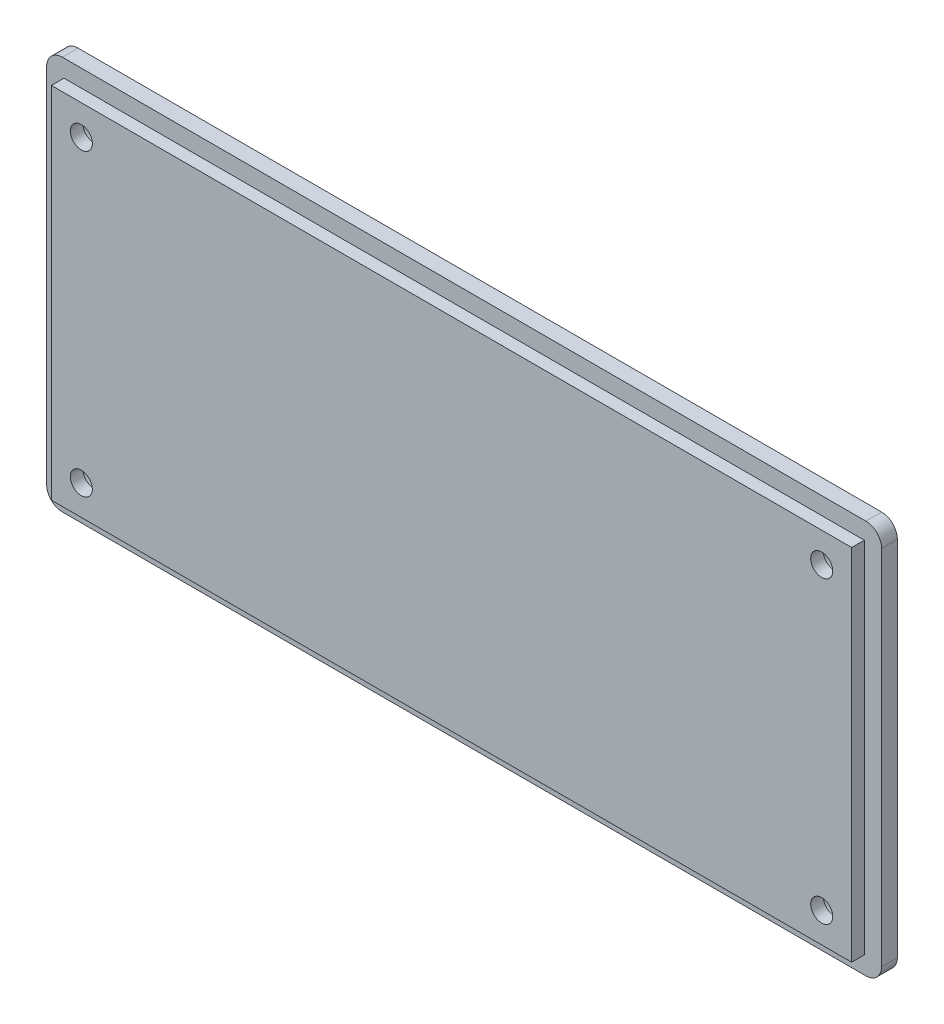
from build123d import *

# Parameters (mm, degrees)
SKETCH_1_W                     = 106
SKETCH_1_H                     = 50
BODY_DEPTH                     = 2
SKETCH_2_W                     = 101.6
SKETCH_2_H                     = 45.6
INTERNALBODY_DEPTH             = 1.6
SKETCH_3_R                     = 1.4
HOLESCREW_DEPTH                = 59.710816721
SKETCH_3_3_R                   = 2.5
SKETCH_3_3_R_2                 = 1.4
TOPSCREWPLACE_DEPTH            = 2
SCREWMIRROR2_COPY_1_SKETCH_R   = 1.4
SCREWMIRROR2_COPY_1_DEPTH      = 59.710816721
SCREWMIRROR2_COPY_2_SKETCH_R   = 2.5
SCREWMIRROR2_COPY_2_SKETCH_R_2 = 1.4
SCREWMIRROR2_COPY_2_DEPTH      = 2
SCREWMIRROR2_COPY_3_SKETCH_R   = 1.4
SCREWMIRROR2_COPY_3_DEPTH      = 59.710816721
CORNERS_R                      = 2


with BuildPart() as part:
    # Эскиз1 → Body (new body)
    with BuildSketch(Plane.XY):
        Rectangle(SKETCH_1_W, SKETCH_1_H)
    extrude(amount=BODY_DEPTH)

    # Эскиз2 → InternalBody (add)
    with BuildSketch(Plane.XY.offset(2)):
        Rectangle(SKETCH_2_W, SKETCH_2_H)
    extrude(amount=INTERNALBODY_DEPTH)

    # Эскиз3 → HoleScrew (cut, through all)
    with BuildSketch(Plane(origin=(0, 0, 0), x_dir=(-1, 0, 0), z_dir=(0, 0, -1))):
        with Locations((47, -19)):
            Circle(SKETCH_3_R)
    holescrew = extrude(amount=-HOLESCREW_DEPTH, mode=Mode.SUBTRACT)

    # Эскиз3<3> → TopScrewPlace (cut)
    with BuildSketch(Plane(origin=(0, 0, 0), x_dir=(-1, 0, 0), z_dir=(0, 0, -1))):
        with Locations((47, -19)):
            Circle(SKETCH_3_3_R)
        with Locations((47, -19)):
            Circle(SKETCH_3_3_R_2, mode=Mode.SUBTRACT)
    topscrewplace = extrude(amount=-TOPSCREWPLACE_DEPTH, mode=Mode.SUBTRACT)

    # ScrewMrror1: HoleScrew, TopScrewPlace across plane
    add(holescrew.mirror(Plane.ZX), mode=Mode.SUBTRACT)
    add(topscrewplace.mirror(Plane.ZX), mode=Mode.SUBTRACT)

    # ScrewMirror2: TopScrewPlace across plane
    add(topscrewplace.mirror(Plane(origin=(0, 0, 0), x_dir=(0, 0, 1), z_dir=(1, 0, 0))), mode=Mode.SUBTRACT)

    # ScrewMirror2 copy 1 sketch → ScrewMirror2 copy 1 (cut, through all)
    with BuildSketch(Plane(origin=(0, 0, 0), x_dir=(1, 0, 0), z_dir=(0, 0, -1))):
        with Locations((47, -19)):
            Circle(SCREWMIRROR2_COPY_1_SKETCH_R)
    extrude(amount=-SCREWMIRROR2_COPY_1_DEPTH, mode=Mode.SUBTRACT)

    # ScrewMirror2 copy 2 sketch → ScrewMirror2 copy 2 (cut)
    with BuildSketch(Plane(origin=(0, 0, 0), x_dir=(1, 0, 0), z_dir=(0, 0, -1))):
        with Locations((47, -19)):
            Circle(SCREWMIRROR2_COPY_2_SKETCH_R)
        with Locations((47, -19)):
            Circle(SCREWMIRROR2_COPY_2_SKETCH_R_2, mode=Mode.SUBTRACT)
    extrude(amount=-SCREWMIRROR2_COPY_2_DEPTH, mode=Mode.SUBTRACT)

    # ScrewMirror2 copy 3 sketch → ScrewMirror2 copy 3 (cut, through all)
    with BuildSketch(Plane(origin=(0, 0, 0), x_dir=(1, 0, 0), z_dir=(0, 0, -1))):
        with Locations((47, 19)):
            Circle(SCREWMIRROR2_COPY_3_SKETCH_R)
    extrude(amount=-SCREWMIRROR2_COPY_3_DEPTH, mode=Mode.SUBTRACT)

    # Corners
    corners_edges = [part.edges().sort_by_distance(p)[0] for p in [
        (-53, -25, 1),
        (53, -25, 1),
        (53, 25, 1),
        (-53, 25, 1),
    ]]
    fillet(corners_edges, radius=CORNERS_R)


solid = part.part
